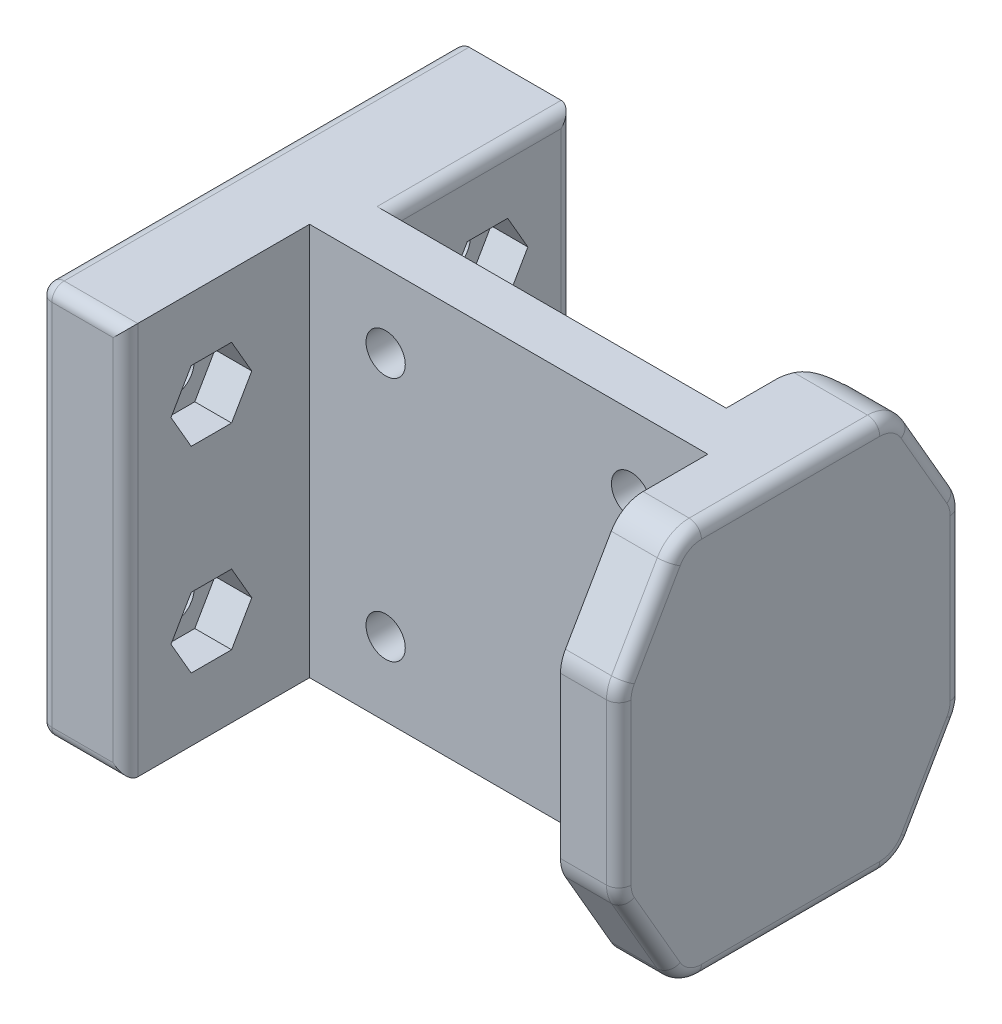
from build123d import *

# Parameters (mm, degrees)
SKETCH_1_W          = 36
SKETCH_1_H          = 32
SKETCH_1_R          = 1.6
EXTRUDE_1_DEPTH     = 4
EXTRUDE_2_DEPTH     = 32
SKETCH_8_R          = 1.6
CUT_EXTRUDE_1_DEPTH = 53.619768148
SKETCH1_W           = 4
SKETCH1_H           = 32
BOSS_EXTRUDE1_DEPTH = 3
SKETCH2_W           = 5
SKETCH2_H           = 32
BOSS_EXTRUDE2_DEPTH = 12
CUT_EXTRUDE1_DEPTH  = 5
BOSS_EXTRUDE5_DEPTH = 5
BOSS_EXTRUDE6_START = 3
SKETCH7_W           = 15
SKETCH7_H           = 32
SKETCH7_R           = 1.6
BOSS_EXTRUDE6_DEPTH = 3
CUT_EXTRUDE2_DEPTH  = 0.25
BOSS_EXTRUDE7_START = 2.5
SKETCH9_W           = 15
SKETCH9_H           = 32
SKETCH9_R           = 1.6
BOSS_EXTRUDE7_DEPTH = 2.5
BOSS_EXTRUDE8_DEPTH = 2.5
CUT_EXTRUDE3_DEPTH  = 2.5
FILLET2_R           = 3
FILLET4_R           = 3
FILLET5_R           = 3
FILLET9_R           = 1
FILLET11_R          = 1
CUT_EXTRUDE4_DEPTH  = 3
CUT_EXTRUDE5_DEPTH  = 3
FILLET14_R          = 1


with BuildPart() as part:
    # Эскиз1 → Бобышка-Вытянуть1 (new body)
    with BuildSketch(Plane.XY):
        with Locations((18, 16)):
            Rectangle(SKETCH_1_W, SKETCH_1_H)
        with Locations((8, 26)):
            Circle(SKETCH_1_R, mode=Mode.SUBTRACT)
        with Locations((28, 26)):
            Circle(SKETCH_1_R, mode=Mode.SUBTRACT)
        with Locations((8, 6)):
            Circle(SKETCH_1_R, mode=Mode.SUBTRACT)
        with Locations((28, 6)):
            Circle(SKETCH_1_R, mode=Mode.SUBTRACT)
    extrude(amount=EXTRUDE_1_DEPTH)

    # Эскиз7 → Бобышка-Вытянуть2 (add)
    with BuildSketch(Plane(origin=(0, 32, 0), x_dir=(1, 0, 0), z_dir=(0, 1, 0))):
        Polygon((0, 0), (-1.2, 0), (-1.2, 15), (-5.2, 15), (-5.2, -19), (-1.2, -19), (-1.2, -4), (0, -4), align=None)
    extrude(amount=-EXTRUDE_2_DEPTH)

    # Эскиз8 → Вырез-Вытянуть1 (cut, through all)
    with BuildSketch(Plane(origin=(-1.2, 0, 0), x_dir=(0, 0, -1), z_dir=(1, 0, 0))):
        with Locations(Location((8, 24, 0), (0, 0, 90))):
            Circle(SKETCH_8_R)
        with Locations(Location((8, 8, 0), (0, 0, 90))):
            Circle(SKETCH_8_R)
        with Locations(Location((-12, 8, 0), (0, 0, 90))):
            Circle(SKETCH_8_R)
        with Locations(Location((-12, 24, 0), (0, 0, 90))):
            Circle(SKETCH_8_R)
    extrude(amount=-CUT_EXTRUDE_1_DEPTH, mode=Mode.SUBTRACT)

    # Sketch1 → Boss-Extrude1 (add)
    with BuildSketch(Plane(origin=(36, 0, 0), x_dir=(0, 0, -1), z_dir=(1, 0, 0))):
        with Locations((-2, 16)):
            Rectangle(SKETCH1_W, SKETCH1_H)
    extrude(amount=BOSS_EXTRUDE1_DEPTH)

    # Sketch2 → Boss-Extrude2 (add)
    with BuildSketch(Plane(origin=(0, 0, 0), x_dir=(-1, 0, 0), z_dir=(0, 0, -1))):
        with Locations((-36.5, 16)):
            Rectangle(SKETCH2_W, SKETCH2_H)
    extrude(amount=BOSS_EXTRUDE2_DEPTH)

    # Sketch3 → Cut-Extrude1 (cut)
    with BuildSketch(Plane(origin=(39, 0, 0), x_dir=(0, 0, -1), z_dir=(1, 0, 0))):
        Polygon((7, 32), (12, 32), (12, 23.339745962), align=None)
        Polygon((12, 8.660254038), (7, 0), (12, 0), align=None)
    extrude(amount=-CUT_EXTRUDE1_DEPTH, mode=Mode.SUBTRACT)

    # Sketch6 → Boss-Extrude5 (add)
    with BuildSketch(Plane(origin=(39, 0, 0), x_dir=(0, 0, -1), z_dir=(1, 0, 0))):
        Polygon((-16, 8.660254038), (-11, 0), (-4, 0), (-4, 32), (-11, 32), (-16, 23.339745962), align=None)
    extrude(amount=-BOSS_EXTRUDE5_DEPTH)

    # Sketch7 → Boss-Extrude6 (add)
    # profile 1 of 2: a face of its own
    with BuildSketch(Plane(origin=(-1.2, 0, 0), x_dir=(0, 0, -1), z_dir=(1, 0, 0)).offset(BOSS_EXTRUDE6_START)):
        with Locations((7.5, 16)):
            Rectangle(SKETCH7_W, SKETCH7_H)
        with Locations(Location((8, 24, 0), (0, 0, 90))):
            Circle(SKETCH7_R, mode=Mode.SUBTRACT)
        with Locations(Location((8, 8, 0), (0, 0, 90))):
            Circle(SKETCH7_R, mode=Mode.SUBTRACT)
    # profile 2 of 2: a face of its own
    with BuildSketch(Plane(origin=(-1.2, 0, 0), x_dir=(0, 0, -1), z_dir=(1, 0, 0)).offset(BOSS_EXTRUDE6_START)):
        with Locations((-11.5, 16)):
            Rectangle(SKETCH7_W, SKETCH7_H)
        with Locations(Location((-12, 24, 0), (0, 0, 90))):
            Circle(SKETCH7_R, mode=Mode.SUBTRACT)
        with Locations(Location((-12, 8, 0), (0, 0, 90))):
            Circle(SKETCH7_R, mode=Mode.SUBTRACT)
    extrude(amount=-BOSS_EXTRUDE6_DEPTH)

    # Sketch8 → Cut-Extrude2 (cut)
    with BuildSketch(Plane.ZY.offset(-34)):
        Polygon((-12, 23.339745962), (-12, 8.660254038), (-7, 0), (0, 0), (0, 32), (-7, 32), align=None)
        Polygon((4, 32), (4, 0), (11, 0), (16, 8.660254038), (16, 23.339745962), (11, 32), align=None)
    extrude(amount=-CUT_EXTRUDE2_DEPTH, mode=Mode.SUBTRACT)

    # Sketch9 → Boss-Extrude7 (add)
    with BuildSketch(Plane(origin=(1.8, 0, 0), x_dir=(0, 0, -1), z_dir=(1, 0, 0)).offset(BOSS_EXTRUDE7_START)):
        with Locations((7.5, 16)):
            Rectangle(SKETCH9_W, SKETCH9_H)
        with Locations(Location((8, 24, 0), (0, 0, 90))):
            Circle(SKETCH9_R, mode=Mode.SUBTRACT)
        with Locations(Location((8, 8, 0), (0, 0, 90))):
            Circle(SKETCH9_R, mode=Mode.SUBTRACT)
    extrude(amount=-BOSS_EXTRUDE7_DEPTH)

    # Sketch10 → Boss-Extrude8 (add)
    with BuildSketch(Plane.ZY.offset(-34.25)):
        Polygon((-7, 32), (-12, 23.339745962), (-12, 8.660254038), (-7, 0), (0, 0), (0, 32), align=None)
    extrude(amount=BOSS_EXTRUDE8_DEPTH)

    # Sketch11 → Cut-Extrude3 (cut)
    with BuildSketch(Plane.ZY.offset(-31.75)):
        Polygon((-7, 32), (-12, 23.339745962), (-12, 8.660254038), (-7, 0), align=None)
    extrude(amount=-CUT_EXTRUDE3_DEPTH, mode=Mode.SUBTRACT)

    # Fillet2
    # the kernel refuses this fillet: 3 mm, written as the material it takes off along each edge
    with BuildSketch(Plane(origin=(31.75, -7.395099729, -7), x_dir=(1, 0, 0), z_dir=(0, 1, 0))) as fillet2_piece_1:
        with BuildLine():
            CenterArc((3, -2.958039892), FILLET2_R, 99.594068227, 80.405931773)
            Line((0, -2.958039892), (-0.06, -2.958039892))
            Line((-0.06, -2.958039892), (-0.06, 0))
            Line((-0.06, 0), (0, 0.06))
            ThreePointArc((0, 0.06), (1.25, 0.06), (2.49, 0.059160798))
            Line((2.49, 0.059160798), (2.5, 0))
        make_face()
    extrude(amount=46.790199458, mode=Mode.SUBTRACT)

    # Fillet4
    fillet4_edges = [part.edges().sort_by_distance(p)[0] for p in [
        (36.625, 32, -7),
        (36.625, 0, -7),
        (36.625, 8.660254038, -12),
        (36.625, 23.339745962, -12),
    ]]
    fillet(fillet4_edges, radius=FILLET4_R)

    # Fillet5
    fillet5_edges = [part.edges().sort_by_distance(p)[0] for p in [
        (36.625, 32, 11),
        (36.625, 23.339745962, 16),
        (36.625, 8.660254038, 16),
        (36.625, 0, 11),
    ]]
    fillet(fillet5_edges, radius=FILLET5_R)

    # Fillet9
    fillet9_edges = [part.edges().sort_by_distance(p)[0] for p in [
        (39, 4.732050808, -9.732050808),
        (39, 16, -12),
        (39, 27.267949192, -9.732050808),
        (39, 32, 2),
        (39, 31.598076211, -6.767949192),
        (39, 23.31235552, -11.897777479),
        (39, 8.68764448, -11.897777479),
        (39, 0.401923789, -6.767949192),
        (39, 4.732050808, 13.732050808),
        (39, 0, 2),
        (39, 27.267949192, 13.732050808),
        (39, 16, 16),
        (39, 31.598076211, 10.767949192),
        (39, 23.31235552, 15.897777479),
        (39, 8.68764448, 15.897777479),
        (39, 0.401923789, 10.767949192),
    ]]
    fillet(fillet9_edges, radius=FILLET9_R)

    # Fillet11
    fillet11_edges = [part.edges().sort_by_distance(p)[0] for p in [
        (1.8, 16, 19),
        (-5.2, 16, 19),
        (-1.7, 32, 19),
        (-1.7, 0, 19),
    ]]
    fillet(fillet11_edges, radius=FILLET11_R)

    # Sketch12 → Cut-Extrude4 (cut)
    with BuildSketch(Plane(origin=(4.3, 0, 0), x_dir=(0, 0, -1), z_dir=(1, 0, 0))):
        Polygon((6.354551733, 26.85), (4.709103466, 24), (6.354551733, 21.15), (9.645448267, 21.15), (11.290896534, 24), (9.645448267, 26.85), align=None)
        Polygon((6.354551733, 10.85), (4.709103466, 8), (6.354551733, 5.15), (9.645448267, 5.15), (11.290896534, 8), (9.645448267, 10.85), align=None)
    extrude(amount=-CUT_EXTRUDE4_DEPTH, mode=Mode.SUBTRACT)

    # Sketch13 → Cut-Extrude5 (cut)
    with BuildSketch(Plane(origin=(1.8, 0, 0), x_dir=(0, 0, -1), z_dir=(1, 0, 0))):
        Polygon((-15.290896534, 24), (-13.645448267, 21.15), (-10.354551733, 21.15), (-8.709103466, 24), (-10.354551733, 26.85), (-13.645448267, 26.85), align=None)
        Polygon((-15.290896534, 8), (-13.645448267, 5.15), (-10.354551733, 5.15), (-8.709103466, 8), (-10.354551733, 10.85), (-13.645448267, 10.85), align=None)
    extrude(amount=-CUT_EXTRUDE5_DEPTH, mode=Mode.SUBTRACT)

    # Fillet14
    # the kernel refuses this fillet: 1 mm, written as the material it takes off along each edge
    with BuildSketch(Plane(origin=(-4.2, 1, 18), x_dir=(-1, 0, 0), z_dir=(0, -1, 0))) as fillet14_piece_1_section:
        Polygon((0, 0), (FILLET14_R, 0), (FILLET14_R, -FILLET14_R), (0, -FILLET14_R), align=None)
    fillet14_piece_1 = extrude(amount=FILLET14_R, mode=Mode.PRIVATE)
    fillet14_piece_1 = fillet14_piece_1 - Plane(origin=(-4.2, 1, 18), x_dir=(0.7071067811865475, 0, -0.7071067811865475), z_dir=(0, -1, 0)) * Sphere(FILLET14_R, mode=Mode.PRIVATE)
    add(fillet14_piece_1, mode=Mode.SUBTRACT)
    with BuildSketch(Plane(origin=(-4.2, 31, 18), x_dir=(0, 1, 0), z_dir=(-1, 0, 0))) as fillet14_piece_2_section:
        Polygon((0, 0), (FILLET14_R, 0), (FILLET14_R, -FILLET14_R), (0, -FILLET14_R), align=None)
    fillet14_piece_2 = extrude(amount=FILLET14_R, mode=Mode.PRIVATE)
    fillet14_piece_2 = fillet14_piece_2 - Plane(origin=(-4.2, 31, 18), x_dir=(0, -0.7071067811865475, -0.7071067811865475), z_dir=(-1, 0, 0)) * Sphere(FILLET14_R, mode=Mode.PRIVATE)
    add(fillet14_piece_2, mode=Mode.SUBTRACT)
    with BuildSketch(Plane(origin=(4.3, 32, -17.5), x_dir=(0, -1, 0), z_dir=(0, 0, 1))) as fillet14_piece_3:
        with BuildLine():
            CenterArc((FILLET14_R, -FILLET14_R), FILLET14_R, 90, 90)
            Line((0, -FILLET14_R), (0, 0))
            Line((0, 0), (FILLET14_R, 0))
        make_face()
    extrude(amount=17.5, mode=Mode.SUBTRACT)
    with BuildSketch(Plane(origin=(4.3, 0, 0), x_dir=(-1, 0, 0), z_dir=(0, 0, -1))) as fillet14_piece_4:
        with BuildLine():
            CenterArc((FILLET14_R, FILLET14_R), FILLET14_R, 180, 90)
            Line((0, FILLET14_R), (0, 0))
            Line((0, 0), (FILLET14_R, 0))
        make_face()
    extrude(amount=17.5, mode=Mode.SUBTRACT)
    with BuildSketch(Plane(origin=(4.3, -2.5, -15), x_dir=(-1, 0, 0), z_dir=(0, 1, 0))) as fillet14_piece_5:
        with BuildLine():
            CenterArc((FILLET14_R, FILLET14_R), FILLET14_R, 180, 90)
            Line((0, FILLET14_R), (0, 0))
            Line((0, 0), (FILLET14_R, 0))
        make_face()
    extrude(amount=37, mode=Mode.SUBTRACT)
    with BuildSketch(Plane(origin=(-5.2, 34.5, -15), x_dir=(0, 0, 1), z_dir=(0, -1, 0))) as fillet14_piece_6:
        with BuildLine():
            CenterArc((FILLET14_R, -FILLET14_R), FILLET14_R, 90, 90)
            Line((0, -FILLET14_R), (0, 0))
            Line((0, 0), (FILLET14_R, 0))
        make_face()
    extrude(amount=37, mode=Mode.SUBTRACT)
    with BuildSketch(Plane(origin=(-5.2, 32, -17.5), x_dir=(0, -1, 0), z_dir=(0, 0, 1)), Plane(origin=(-5.2, 0, -17.5), x_dir=(1, 0, 0), z_dir=(0, 0, 1))) as fillet14_piece_7:
        with BuildLine():
            CenterArc((FILLET14_R, FILLET14_R), FILLET14_R, 180, 90)
            Line((0, FILLET14_R), (0, 0))
            Line((0, 0), (FILLET14_R, 0))
        make_face()
    extrude(amount=35.5, mode=Mode.SUBTRACT)


solid = part.part
